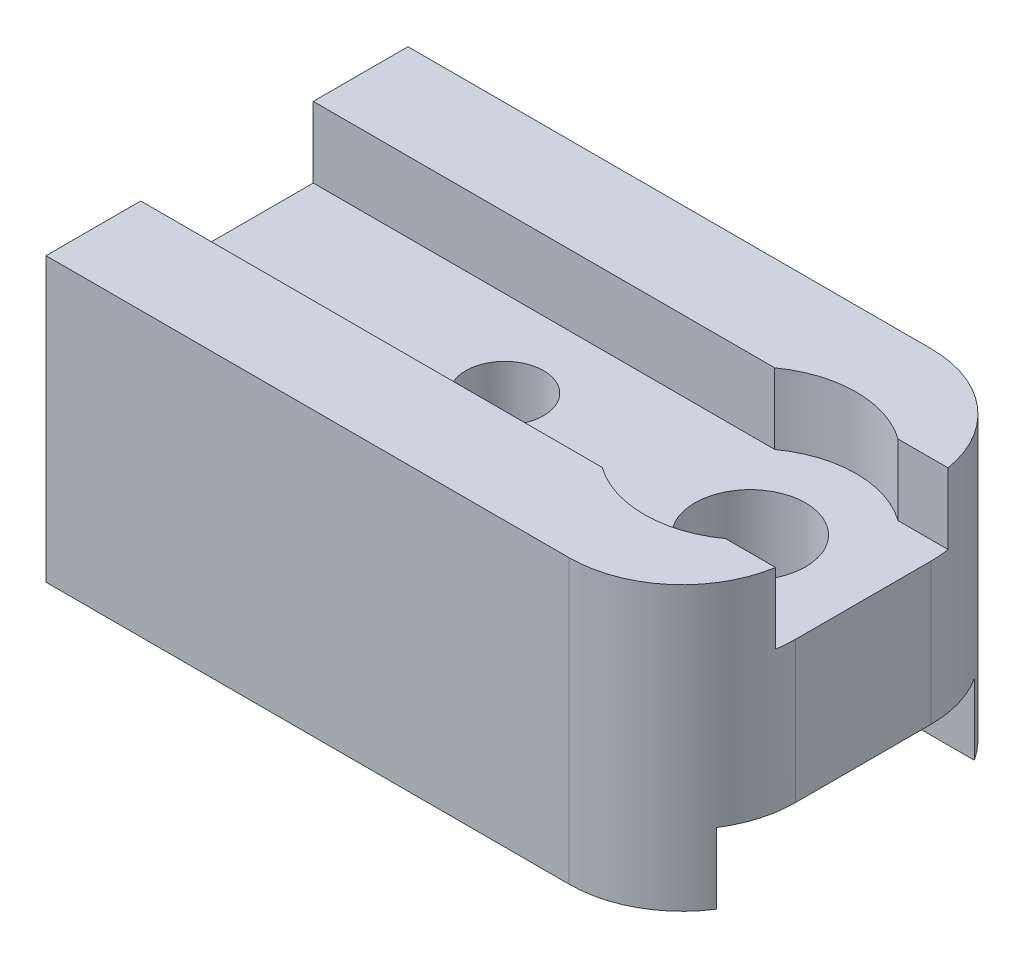
from build123d import *

# Parameters (mm, degrees)
SKETCH1_W           = 28.575
SKETCH1_H           = 16.256
SKETCH1_R           = 2.4892
SKETCH1_R_2         = 1.75
BOSS_EXTRUDE1_DEPTH = 12.7
SKETCH2_W           = 36.398054667
SKETCH2_H           = 7.747
CUT_EXTRUDE1_DEPTH  = 3.175
SKETCH3_W           = 33.032622038
SKETCH3_H           = 11.5824
CUT_EXTRUDE2_DEPTH  = 3.175
SKETCH4_R           = 3.7465
CUT_EXTRUDE3_DEPTH  = 3.6322
FILLET1_R           = 5.08
SKETCH5_R           = 4.7625
CUT_EXTRUDE4_DEPTH  = 35.227383569


with BuildPart() as part:
    # Sketch1 → Boss-Extrude1 (new body)
    with BuildSketch(Plane(origin=(0, 0, 0), x_dir=(1, 0, 0), z_dir=(0, 1, 0))):
        with Locations((14.2875, 8.128)):
            Rectangle(SKETCH1_W, SKETCH1_H)
        with Locations((23.495, 8.128)):
            Circle(SKETCH1_R, mode=Mode.SUBTRACT)
        with Locations((12.4714, 8.128)):
            Circle(SKETCH1_R_2, mode=Mode.SUBTRACT)
    extrude(amount=BOSS_EXTRUDE1_DEPTH)

    # Sketch2 → Cut-Extrude1 (cut)
    with BuildSketch(Plane(origin=(0, 12.7, 0), x_dir=(1, 0, 0), z_dir=(0, 1, 0))):
        with Locations((15.783080999, 8.128)):
            Rectangle(SKETCH2_W, SKETCH2_H)
    extrude(amount=-CUT_EXTRUDE1_DEPTH, mode=Mode.SUBTRACT)

    # Sketch3 → Cut-Extrude2 (cut)
    with BuildSketch(Plane.XZ):
        with Locations((15.449592918, -8.128)):
            Rectangle(SKETCH3_W, SKETCH3_H)
    extrude(amount=-CUT_EXTRUDE2_DEPTH, mode=Mode.SUBTRACT)

    # Sketch4 → Cut-Extrude3 (cut)
    with BuildSketch(Plane.XZ.offset(-3.175)):
        with Locations((12.4714, -8.128)):
            Circle(SKETCH4_R)
    extrude(amount=-CUT_EXTRUDE3_DEPTH, mode=Mode.SUBTRACT)

    # Fillet1
    fillet1_edges = [part.edges().sort_by_distance(p)[0] for p in [
        (28.575, 6.35, -16.256),
        (28.575, 6.35, 0),
    ]]
    fillet(fillet1_edges, radius=FILLET1_R)

    # Sketch5 → Cut-Extrude4 (cut, through all)
    with BuildSketch(Plane(origin=(0, 9.525, 0), x_dir=(1, 0, 0), z_dir=(0, 1, 0))):
        with Locations((23.495, 8.128)):
            Circle(SKETCH5_R)
    extrude(amount=CUT_EXTRUDE4_DEPTH, mode=Mode.SUBTRACT)


solid = part.part
